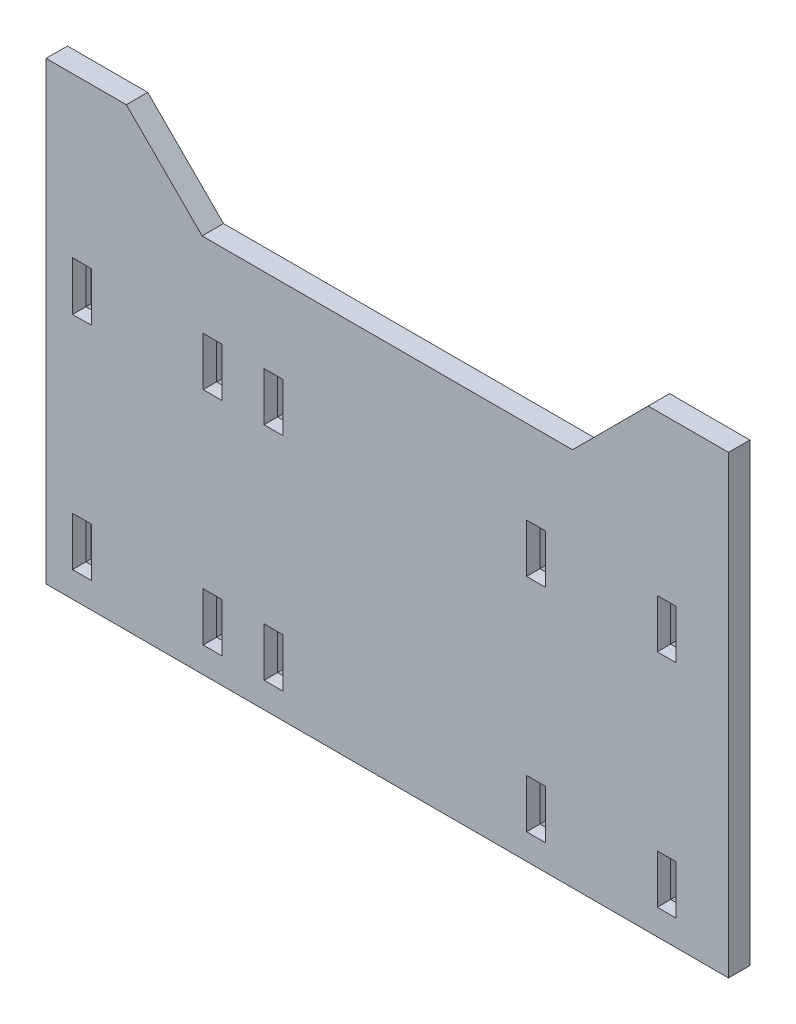
from build123d import *
from OCP.BRepFilletAPI import BRepFilletAPI_MakeChamfer

# Parameters (mm, degrees)
SKETCH1_W           = 127.440194606
SKETCH1_H           = 60
SKETCH1_W_2         = 3.53
SKETCH1_H_2         = 9.11399265
BOSS_EXTRUDE1_DEPTH = 4
BOSS_EXTRUDE2_DEPTH = 4
CHAMFER1_SIZE       = 1.5
CHAMFER1_SIZE2      = 0.5


with BuildPart() as part:
    # Sketch1 → Boss-Extrude1 (new body)
    with BuildSketch(Plane.XY):
        Rectangle(SKETCH1_W, SKETCH1_H)
        with Locations((-32.620097303, 20.65)):
            Rectangle(SKETCH1_W_2, SKETCH1_H_2, mode=Mode.SUBTRACT)
        with Locations((27.7799027, 20.65)):
            Rectangle(SKETCH1_W_2, SKETCH1_H_2, mode=Mode.SUBTRACT)
        with Locations((27.7799027, -20.65)):
            Rectangle(SKETCH1_W_2, SKETCH1_H_2, mode=Mode.SUBTRACT)
        Polygon((-19.455133439, 25.206990566), (-22.985061166, 25.184401952), (-22.999551776, 16.115598048), (-19.440642829, 16.093009434), align=None, mode=Mode.SUBTRACT)
        with Locations((-21.220097303, -20.65)):
            Rectangle(SKETCH1_W_2, SKETCH1_H_2, mode=Mode.SUBTRACT)
        with Locations((52.1799027, 20.65)):
            Rectangle(SKETCH1_W_2, SKETCH1_H_2, mode=Mode.SUBTRACT)
        with Locations((52.1799027, -20.65)):
            Rectangle(SKETCH1_W_2, SKETCH1_H_2, mode=Mode.SUBTRACT)
        with Locations((-32.620097303, -20.65)):
            Rectangle(SKETCH1_W_2, SKETCH1_H_2, mode=Mode.SUBTRACT)
        Polygon((-58.784966326, 25.25), (-55.255228279, 25.206996325), (-55.255228279, 16.093003675), (-58.784966326, 16.05), align=None, mode=Mode.SUBTRACT)
        with Locations((-57.020097303, -20.65)):
            Rectangle(SKETCH1_W_2, SKETCH1_H_2, mode=Mode.SUBTRACT)
    extrude(amount=-BOSS_EXTRUDE1_DEPTH)

    # Sketch2 → Boss-Extrude2 (add)
    with BuildSketch(Plane.XY):
        Polygon((-63.720097303, 30), (-63.720097303, 55), (-48.720097303, 55), (-34.577961679, 40.857864376), (34.577961679, 40.857864376), (48.720097303, 55), (63.720097303, 55), (63.720097303, 30), align=None)
    extrude(amount=-BOSS_EXTRUDE2_DEPTH)

    # Chamfer1: one chamfer whose edges measure the first distance from different faces: ONE call of the kernel's chamfer builder (chamfer() names one face for all edges)
    chamfer1_edges_1 = [part.edges().sort_by_distance(p)[0] for p in [
        (27.7799027, 16.093003675, -4),
    ]]
    chamfer1_side_1 = [part.faces().sort_by_distance(p)[0] for p in [
        (27.7799027, 16.093003675, -2),
    ]]
    chamfer1_edges_2 = [part.edges().sort_by_distance(p)[0] for p in [
        (29.5449027, 20.65, -4),
    ]]
    chamfer1_side_2 = [part.faces().sort_by_distance(p)[0] for p in [
        (29.5449027, 20.65, -2),
    ]]
    chamfer1_edges_3 = [part.edges().sort_by_distance(p)[0] for p in [
        (26.0149027, 20.65, -4),
    ]]
    chamfer1_side_3 = [part.faces().sort_by_distance(p)[0] for p in [
        (26.0149027, 20.65, -2),
    ]]
    chamfer1_edges_4 = [part.edges().sort_by_distance(p)[0] for p in [
        (27.7799027, 25.206996325, -4),
    ]]
    chamfer1_side_4 = [part.faces().sort_by_distance(p)[0] for p in [
        (27.7799027, 25.206996325, -2),
    ]]
    chamfer1_edges_5 = [part.edges().sort_by_distance(p)[0] for p in [
        (53.9449027, 20.65, -4),
    ]]
    chamfer1_side_5 = [part.faces().sort_by_distance(p)[0] for p in [
        (53.9449027, 20.65, -2),
    ]]
    chamfer1_edges_6 = [part.edges().sort_by_distance(p)[0] for p in [
        (52.1799027, 16.093003675, -4),
    ]]
    chamfer1_side_6 = [part.faces().sort_by_distance(p)[0] for p in [
        (52.1799027, 16.093003675, -2),
    ]]
    chamfer1_edges_7 = [part.edges().sort_by_distance(p)[0] for p in [
        (50.4149027, 20.65, -4),
    ]]
    chamfer1_side_7 = [part.faces().sort_by_distance(p)[0] for p in [
        (50.4149027, 20.65, -2),
    ]]
    chamfer1_edges_8 = [part.edges().sort_by_distance(p)[0] for p in [
        (52.1799027, 25.206996325, -4),
    ]]
    chamfer1_side_8 = [part.faces().sort_by_distance(p)[0] for p in [
        (52.1799027, 25.206996325, -2),
    ]]
    chamfer1_edges_9 = [part.edges().sort_by_distance(p)[0] for p in [
        (52.1799027, -25.206996325, -4),
    ]]
    chamfer1_side_9 = [part.faces().sort_by_distance(p)[0] for p in [
        (52.1799027, -25.206996325, -2),
    ]]
    chamfer1_edges_10 = [part.edges().sort_by_distance(p)[0] for p in [
        (53.9449027, -20.65, -4),
    ]]
    chamfer1_side_10 = [part.faces().sort_by_distance(p)[0] for p in [
        (53.9449027, -20.65, -2),
    ]]
    chamfer1_edges_11 = [part.edges().sort_by_distance(p)[0] for p in [
        (52.1799027, -16.093003675, -4),
    ]]
    chamfer1_side_11 = [part.faces().sort_by_distance(p)[0] for p in [
        (52.1799027, -16.093003675, -2),
    ]]
    chamfer1_edges_12 = [part.edges().sort_by_distance(p)[0] for p in [
        (50.4149027, -20.65, -4),
    ]]
    chamfer1_side_12 = [part.faces().sort_by_distance(p)[0] for p in [
        (50.4149027, -20.65, -2),
    ]]
    chamfer1_edges_13 = [part.edges().sort_by_distance(p)[0] for p in [
        (29.5449027, -20.65, -4),
    ]]
    chamfer1_side_13 = [part.faces().sort_by_distance(p)[0] for p in [
        (29.5449027, -20.65, -2),
    ]]
    chamfer1_edges_14 = [part.edges().sort_by_distance(p)[0] for p in [
        (27.7799027, -25.206996325, -4),
    ]]
    chamfer1_side_14 = [part.faces().sort_by_distance(p)[0] for p in [
        (27.7799027, -25.206996325, -2),
    ]]
    chamfer1_edges_15 = [part.edges().sort_by_distance(p)[0] for p in [
        (26.0149027, -20.65, -4),
    ]]
    chamfer1_side_15 = [part.faces().sort_by_distance(p)[0] for p in [
        (26.0149027, -20.65, -2),
    ]]
    chamfer1_edges_16 = [part.edges().sort_by_distance(p)[0] for p in [
        (27.7799027, -16.093003675, -4),
    ]]
    chamfer1_side_16 = [part.faces().sort_by_distance(p)[0] for p in [
        (27.7799027, -16.093003675, -2),
    ]]
    chamfer1_edges_17 = [part.edges().sort_by_distance(p)[0] for p in [
        (-21.220097303, -25.206996325, -4),
    ]]
    chamfer1_side_17 = [part.faces().sort_by_distance(p)[0] for p in [
        (-21.220097303, -25.206996325, -2),
    ]]
    chamfer1_edges_18 = [part.edges().sort_by_distance(p)[0] for p in [
        (-19.455097303, -20.65, -4),
    ]]
    chamfer1_side_18 = [part.faces().sort_by_distance(p)[0] for p in [
        (-19.455097303, -20.65, -2),
    ]]
    chamfer1_edges_19 = [part.edges().sort_by_distance(p)[0] for p in [
        (-21.220097303, -16.093003675, -4),
    ]]
    chamfer1_side_19 = [part.faces().sort_by_distance(p)[0] for p in [
        (-21.220097303, -16.093003675, -2),
    ]]
    chamfer1_edges_20 = [part.edges().sort_by_distance(p)[0] for p in [
        (-22.985097303, -20.65, -4),
    ]]
    chamfer1_side_20 = [part.faces().sort_by_distance(p)[0] for p in [
        (-22.985097303, -20.65, -2),
    ]]
    chamfer1_edges_21 = [part.edges().sort_by_distance(p)[0] for p in [
        (-30.855097303, -20.65, -4),
    ]]
    chamfer1_side_21 = [part.faces().sort_by_distance(p)[0] for p in [
        (-30.855097303, -20.65, -2),
    ]]
    chamfer1_edges_22 = [part.edges().sort_by_distance(p)[0] for p in [
        (-32.620097303, -25.206996325, -4),
    ]]
    chamfer1_side_22 = [part.faces().sort_by_distance(p)[0] for p in [
        (-32.620097303, -25.206996325, -2),
    ]]
    chamfer1_edges_23 = [part.edges().sort_by_distance(p)[0] for p in [
        (-34.385097303, -20.65, -4),
    ]]
    chamfer1_side_23 = [part.faces().sort_by_distance(p)[0] for p in [
        (-34.385097303, -20.65, -2),
    ]]
    chamfer1_edges_24 = [part.edges().sort_by_distance(p)[0] for p in [
        (-32.620097303, -16.093003675, -4),
    ]]
    chamfer1_side_24 = [part.faces().sort_by_distance(p)[0] for p in [
        (-32.620097303, -16.093003675, -2),
    ]]
    chamfer1_edges_25 = [part.edges().sort_by_distance(p)[0] for p in [
        (-55.255097303, -20.65, -4),
    ]]
    chamfer1_side_25 = [part.faces().sort_by_distance(p)[0] for p in [
        (-55.255097303, -20.65, -2),
    ]]
    chamfer1_edges_26 = [part.edges().sort_by_distance(p)[0] for p in [
        (-57.020097303, -16.093003675, -4),
    ]]
    chamfer1_side_26 = [part.faces().sort_by_distance(p)[0] for p in [
        (-57.020097303, -16.093003675, -2),
    ]]
    chamfer1_edges_27 = [part.edges().sort_by_distance(p)[0] for p in [
        (-58.785097303, -20.65, -4),
    ]]
    chamfer1_side_27 = [part.faces().sort_by_distance(p)[0] for p in [
        (-58.785097303, -20.65, -2),
    ]]
    chamfer1_edges_28 = [part.edges().sort_by_distance(p)[0] for p in [
        (-57.020097303, -25.206996325, -4),
    ]]
    chamfer1_side_28 = [part.faces().sort_by_distance(p)[0] for p in [
        (-57.020097303, -25.206996325, -2),
    ]]
    chamfer1_edges_29 = [part.edges().sort_by_distance(p)[0] for p in [
        (-21.220097303, 25.195696259, -4),
    ]]
    chamfer1_side_29 = [part.faces().sort_by_distance(p)[0] for p in [
        (-21.220097303, 25.195696259, -2),
    ]]
    chamfer1_edges_30 = [part.edges().sort_by_distance(p)[0] for p in [
        (-19.447888134, 20.65, -4),
    ]]
    chamfer1_side_30 = [part.faces().sort_by_distance(p)[0] for p in [
        (-19.447888134, 20.65, -2),
    ]]
    chamfer1_edges_31 = [part.edges().sort_by_distance(p)[0] for p in [
        (-21.220097303, 16.104303741, -4),
    ]]
    chamfer1_side_31 = [part.faces().sort_by_distance(p)[0] for p in [
        (-21.220097303, 16.104303741, -2),
    ]]
    chamfer1_edges_32 = [part.edges().sort_by_distance(p)[0] for p in [
        (-22.992306471, 20.65, -4),
    ]]
    chamfer1_side_32 = [part.faces().sort_by_distance(p)[0] for p in [
        (-22.992306471, 20.65, -2),
    ]]
    chamfer1_edges_33 = [part.edges().sort_by_distance(p)[0] for p in [
        (-32.620097303, 16.093003675, -4),
    ]]
    chamfer1_side_33 = [part.faces().sort_by_distance(p)[0] for p in [
        (-32.620097303, 16.093003675, -2),
    ]]
    chamfer1_edges_34 = [part.edges().sort_by_distance(p)[0] for p in [
        (-30.855097303, 20.65, -4),
    ]]
    chamfer1_side_34 = [part.faces().sort_by_distance(p)[0] for p in [
        (-30.855097303, 20.65, -2),
    ]]
    chamfer1_edges_35 = [part.edges().sort_by_distance(p)[0] for p in [
        (-32.620097303, 25.206996325, -4),
    ]]
    chamfer1_side_35 = [part.faces().sort_by_distance(p)[0] for p in [
        (-32.620097303, 25.206996325, -2),
    ]]
    chamfer1_edges_36 = [part.edges().sort_by_distance(p)[0] for p in [
        (-34.385097303, 20.65, -4),
    ]]
    chamfer1_side_36 = [part.faces().sort_by_distance(p)[0] for p in [
        (-34.385097303, 20.65, -2),
    ]]
    chamfer1_edges_37 = [part.edges().sort_by_distance(p)[0] for p in [
        (-57.020097303, 16.071501837, -4),
    ]]
    chamfer1_side_37 = [part.faces().sort_by_distance(p)[0] for p in [
        (-57.020097303, 16.071501837, -2),
    ]]
    chamfer1_edges_38 = [part.edges().sort_by_distance(p)[0] for p in [
        (-55.255228279, 20.65, -4),
    ]]
    chamfer1_side_38 = [part.faces().sort_by_distance(p)[0] for p in [
        (-55.255228279, 20.65, -2),
    ]]
    chamfer1_edges_39 = [part.edges().sort_by_distance(p)[0] for p in [
        (-57.020097303, 25.228498163, -4),
    ]]
    chamfer1_side_39 = [part.faces().sort_by_distance(p)[0] for p in [
        (-57.020097303, 25.228498163, -2),
    ]]
    chamfer1_edges_40 = [part.edges().sort_by_distance(p)[0] for p in [
        (-58.784966326, 20.65, -4),
    ]]
    chamfer1_side_40 = [part.faces().sort_by_distance(p)[0] for p in [
        (-58.784966326, 20.65, -2),
    ]]
    chamfer1 = BRepFilletAPI_MakeChamfer(part.part.solid().wrapped)
    for e in chamfer1_edges_1:
        chamfer1.Add(CHAMFER1_SIZE, CHAMFER1_SIZE2, e.wrapped, chamfer1_side_1[0].wrapped)  # the first distance lies on this face
    for e in chamfer1_edges_2:
        chamfer1.Add(CHAMFER1_SIZE, CHAMFER1_SIZE2, e.wrapped, chamfer1_side_2[0].wrapped)  # the first distance lies on this face
    for e in chamfer1_edges_3:
        chamfer1.Add(CHAMFER1_SIZE, CHAMFER1_SIZE2, e.wrapped, chamfer1_side_3[0].wrapped)  # the first distance lies on this face
    for e in chamfer1_edges_4:
        chamfer1.Add(CHAMFER1_SIZE, CHAMFER1_SIZE2, e.wrapped, chamfer1_side_4[0].wrapped)  # the first distance lies on this face
    for e in chamfer1_edges_5:
        chamfer1.Add(CHAMFER1_SIZE, CHAMFER1_SIZE2, e.wrapped, chamfer1_side_5[0].wrapped)  # the first distance lies on this face
    for e in chamfer1_edges_6:
        chamfer1.Add(CHAMFER1_SIZE, CHAMFER1_SIZE2, e.wrapped, chamfer1_side_6[0].wrapped)  # the first distance lies on this face
    for e in chamfer1_edges_7:
        chamfer1.Add(CHAMFER1_SIZE, CHAMFER1_SIZE2, e.wrapped, chamfer1_side_7[0].wrapped)  # the first distance lies on this face
    for e in chamfer1_edges_8:
        chamfer1.Add(CHAMFER1_SIZE, CHAMFER1_SIZE2, e.wrapped, chamfer1_side_8[0].wrapped)  # the first distance lies on this face
    for e in chamfer1_edges_9:
        chamfer1.Add(CHAMFER1_SIZE, CHAMFER1_SIZE2, e.wrapped, chamfer1_side_9[0].wrapped)  # the first distance lies on this face
    for e in chamfer1_edges_10:
        chamfer1.Add(CHAMFER1_SIZE, CHAMFER1_SIZE2, e.wrapped, chamfer1_side_10[0].wrapped)  # the first distance lies on this face
    for e in chamfer1_edges_11:
        chamfer1.Add(CHAMFER1_SIZE, CHAMFER1_SIZE2, e.wrapped, chamfer1_side_11[0].wrapped)  # the first distance lies on this face
    for e in chamfer1_edges_12:
        chamfer1.Add(CHAMFER1_SIZE, CHAMFER1_SIZE2, e.wrapped, chamfer1_side_12[0].wrapped)  # the first distance lies on this face
    for e in chamfer1_edges_13:
        chamfer1.Add(CHAMFER1_SIZE, CHAMFER1_SIZE2, e.wrapped, chamfer1_side_13[0].wrapped)  # the first distance lies on this face
    for e in chamfer1_edges_14:
        chamfer1.Add(CHAMFER1_SIZE, CHAMFER1_SIZE2, e.wrapped, chamfer1_side_14[0].wrapped)  # the first distance lies on this face
    for e in chamfer1_edges_15:
        chamfer1.Add(CHAMFER1_SIZE, CHAMFER1_SIZE2, e.wrapped, chamfer1_side_15[0].wrapped)  # the first distance lies on this face
    for e in chamfer1_edges_16:
        chamfer1.Add(CHAMFER1_SIZE, CHAMFER1_SIZE2, e.wrapped, chamfer1_side_16[0].wrapped)  # the first distance lies on this face
    for e in chamfer1_edges_17:
        chamfer1.Add(CHAMFER1_SIZE, CHAMFER1_SIZE2, e.wrapped, chamfer1_side_17[0].wrapped)  # the first distance lies on this face
    for e in chamfer1_edges_18:
        chamfer1.Add(CHAMFER1_SIZE, CHAMFER1_SIZE2, e.wrapped, chamfer1_side_18[0].wrapped)  # the first distance lies on this face
    for e in chamfer1_edges_19:
        chamfer1.Add(CHAMFER1_SIZE, CHAMFER1_SIZE2, e.wrapped, chamfer1_side_19[0].wrapped)  # the first distance lies on this face
    for e in chamfer1_edges_20:
        chamfer1.Add(CHAMFER1_SIZE, CHAMFER1_SIZE2, e.wrapped, chamfer1_side_20[0].wrapped)  # the first distance lies on this face
    for e in chamfer1_edges_21:
        chamfer1.Add(CHAMFER1_SIZE, CHAMFER1_SIZE2, e.wrapped, chamfer1_side_21[0].wrapped)  # the first distance lies on this face
    for e in chamfer1_edges_22:
        chamfer1.Add(CHAMFER1_SIZE, CHAMFER1_SIZE2, e.wrapped, chamfer1_side_22[0].wrapped)  # the first distance lies on this face
    for e in chamfer1_edges_23:
        chamfer1.Add(CHAMFER1_SIZE, CHAMFER1_SIZE2, e.wrapped, chamfer1_side_23[0].wrapped)  # the first distance lies on this face
    for e in chamfer1_edges_24:
        chamfer1.Add(CHAMFER1_SIZE, CHAMFER1_SIZE2, e.wrapped, chamfer1_side_24[0].wrapped)  # the first distance lies on this face
    for e in chamfer1_edges_25:
        chamfer1.Add(CHAMFER1_SIZE, CHAMFER1_SIZE2, e.wrapped, chamfer1_side_25[0].wrapped)  # the first distance lies on this face
    for e in chamfer1_edges_26:
        chamfer1.Add(CHAMFER1_SIZE, CHAMFER1_SIZE2, e.wrapped, chamfer1_side_26[0].wrapped)  # the first distance lies on this face
    for e in chamfer1_edges_27:
        chamfer1.Add(CHAMFER1_SIZE, CHAMFER1_SIZE2, e.wrapped, chamfer1_side_27[0].wrapped)  # the first distance lies on this face
    for e in chamfer1_edges_28:
        chamfer1.Add(CHAMFER1_SIZE, CHAMFER1_SIZE2, e.wrapped, chamfer1_side_28[0].wrapped)  # the first distance lies on this face
    for e in chamfer1_edges_29:
        chamfer1.Add(CHAMFER1_SIZE, CHAMFER1_SIZE2, e.wrapped, chamfer1_side_29[0].wrapped)  # the first distance lies on this face
    for e in chamfer1_edges_30:
        chamfer1.Add(CHAMFER1_SIZE, CHAMFER1_SIZE2, e.wrapped, chamfer1_side_30[0].wrapped)  # the first distance lies on this face
    for e in chamfer1_edges_31:
        chamfer1.Add(CHAMFER1_SIZE, CHAMFER1_SIZE2, e.wrapped, chamfer1_side_31[0].wrapped)  # the first distance lies on this face
    for e in chamfer1_edges_32:
        chamfer1.Add(CHAMFER1_SIZE, CHAMFER1_SIZE2, e.wrapped, chamfer1_side_32[0].wrapped)  # the first distance lies on this face
    for e in chamfer1_edges_33:
        chamfer1.Add(CHAMFER1_SIZE, CHAMFER1_SIZE2, e.wrapped, chamfer1_side_33[0].wrapped)  # the first distance lies on this face
    for e in chamfer1_edges_34:
        chamfer1.Add(CHAMFER1_SIZE, CHAMFER1_SIZE2, e.wrapped, chamfer1_side_34[0].wrapped)  # the first distance lies on this face
    for e in chamfer1_edges_35:
        chamfer1.Add(CHAMFER1_SIZE, CHAMFER1_SIZE2, e.wrapped, chamfer1_side_35[0].wrapped)  # the first distance lies on this face
    for e in chamfer1_edges_36:
        chamfer1.Add(CHAMFER1_SIZE, CHAMFER1_SIZE2, e.wrapped, chamfer1_side_36[0].wrapped)  # the first distance lies on this face
    for e in chamfer1_edges_37:
        chamfer1.Add(CHAMFER1_SIZE, CHAMFER1_SIZE2, e.wrapped, chamfer1_side_37[0].wrapped)  # the first distance lies on this face
    for e in chamfer1_edges_38:
        chamfer1.Add(CHAMFER1_SIZE, CHAMFER1_SIZE2, e.wrapped, chamfer1_side_38[0].wrapped)  # the first distance lies on this face
    for e in chamfer1_edges_39:
        chamfer1.Add(CHAMFER1_SIZE, CHAMFER1_SIZE2, e.wrapped, chamfer1_side_39[0].wrapped)  # the first distance lies on this face
    for e in chamfer1_edges_40:
        chamfer1.Add(CHAMFER1_SIZE, CHAMFER1_SIZE2, e.wrapped, chamfer1_side_40[0].wrapped)  # the first distance lies on this face
    add(Compound.cast(chamfer1.Shape()), mode=Mode.REPLACE)


solid = part.part
